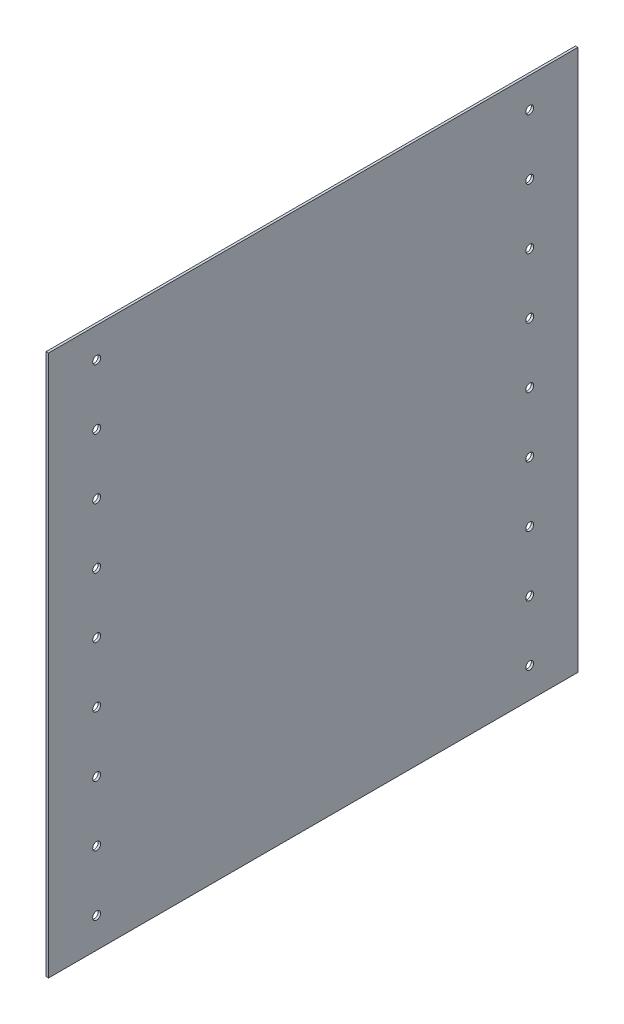
from build123d import *

# Parameters (mm, degrees)
SKETCH_1_W             = 2
SKETCH_1_H             = 450
SM_BASE_FLANGE_1_DEPTH = 440
HOLE_WIZARD_M61_D      = 6.6
HOLE_WIZARD_M61_DEPTH  = 5
HOLE_WIZARD_M61_TIP    = 1.982840043


# Sheet-metal steps are written as plain solids
with BuildPart() as part:
    # Sketch 1 → Базовая кромка1 (new body)
    with BuildSketch(Plane.XY):
        with Locations((1, 225)):
            Rectangle(SKETCH_1_W, SKETCH_1_H)
    extrude(amount=SM_BASE_FLANGE_1_DEPTH)

    # Отверстие с зазором M61
    with Locations(Plane(origin=(2, 0, 0), x_dir=(0, 0, -1), z_dir=(1, 0, 0))):
        with Locations((-400, 425), (-400, 375), (-400, 325), (-400, 275), (-400, 225), (-400, 175), (-400, 125), (-400, 75), (-400, 25), (-40, 25), (-40, 75), (-40, 125), (-40, 175), (-40, 225), (-40, 275), (-40, 325), (-40, 375), (-40, 425)):
            Hole(HOLE_WIZARD_M61_D / 2, depth=HOLE_WIZARD_M61_DEPTH)
            with Locations((0, 0, -(HOLE_WIZARD_M61_DEPTH + HOLE_WIZARD_M61_TIP / 2))):  # 118° drill point
                Cone(0, HOLE_WIZARD_M61_D / 2, HOLE_WIZARD_M61_TIP, mode=Mode.SUBTRACT)


solid = part.part
